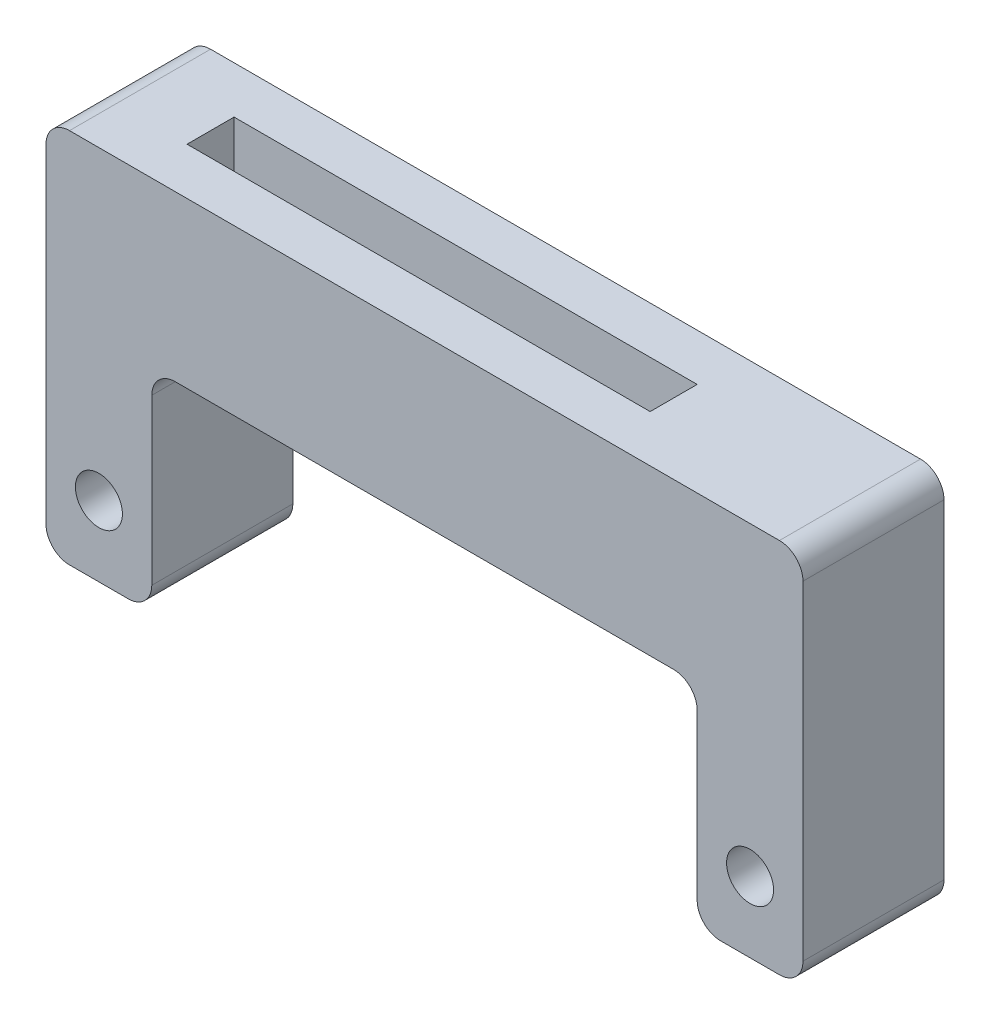
from build123d import *

# Parameters (mm, degrees)
SKETCH2_W           = 32.2
SKETCH2_H           = 16
BOSS_EXTRUDE1_DEPTH = 3
SKETCH3_W           = 19.7
SKETCH3_H           = 2
CUT_EXTRUDE1_DEPTH  = 4
SKETCH4_W           = 23.2
SKETCH4_H           = 9
CUT_EXTRUDE2_DEPTH  = 19.952836199
SKETCH5_R           = 1
CUT_EXTRUDE3_DEPTH  = 19.952836199
FILLET1_R           = 1


with BuildPart() as part:
    # Sketch2 → Boss-Extrude1 (new, symmetric)
    with BuildSketch(Plane.XY):
        Rectangle(SKETCH2_W, SKETCH2_H)
    extrude(amount=BOSS_EXTRUDE1_DEPTH, both=True)

    # Sketch3 → Cut-Extrude1 (cut)
    with BuildSketch(Plane(origin=(0, 8, 0), x_dir=(1, 0, 0), z_dir=(0, 1, 0))):
        with Locations((-2.25, 0)):
            Rectangle(SKETCH3_W, SKETCH3_H)
    extrude(amount=-CUT_EXTRUDE1_DEPTH, mode=Mode.SUBTRACT)

    # Sketch4 → Cut-Extrude2 (cut, through all)
    with BuildSketch(Plane.XY.offset(3)):
        with Locations((0, -3.5)):
            Rectangle(SKETCH4_W, SKETCH4_H)
    extrude(amount=-CUT_EXTRUDE2_DEPTH, mode=Mode.SUBTRACT)

    # Sketch5 → Cut-Extrude3 (cut, through all)
    with BuildSketch(Plane.XY.offset(3)):
        with Locations((-13.85, -5)):
            Circle(SKETCH5_R)
        with Locations((13.85, -5)):
            Circle(SKETCH5_R)
    extrude(amount=-CUT_EXTRUDE3_DEPTH, mode=Mode.SUBTRACT)

    # Fillet1
    fillet1_edges = [part.edges().sort_by_distance(p)[0] for p in [
        (16.1, 8, 0),
        (16.1, -8, 0),
        (11.6, -8, 0),
        (11.6, 1, 0),
        (-11.6, 1, 0),
        (-11.6, -8, 0),
        (-16.1, -8, 0),
        (-16.1, 8, 0),
    ]]
    fillet(fillet1_edges, radius=FILLET1_R)


solid = part.part
